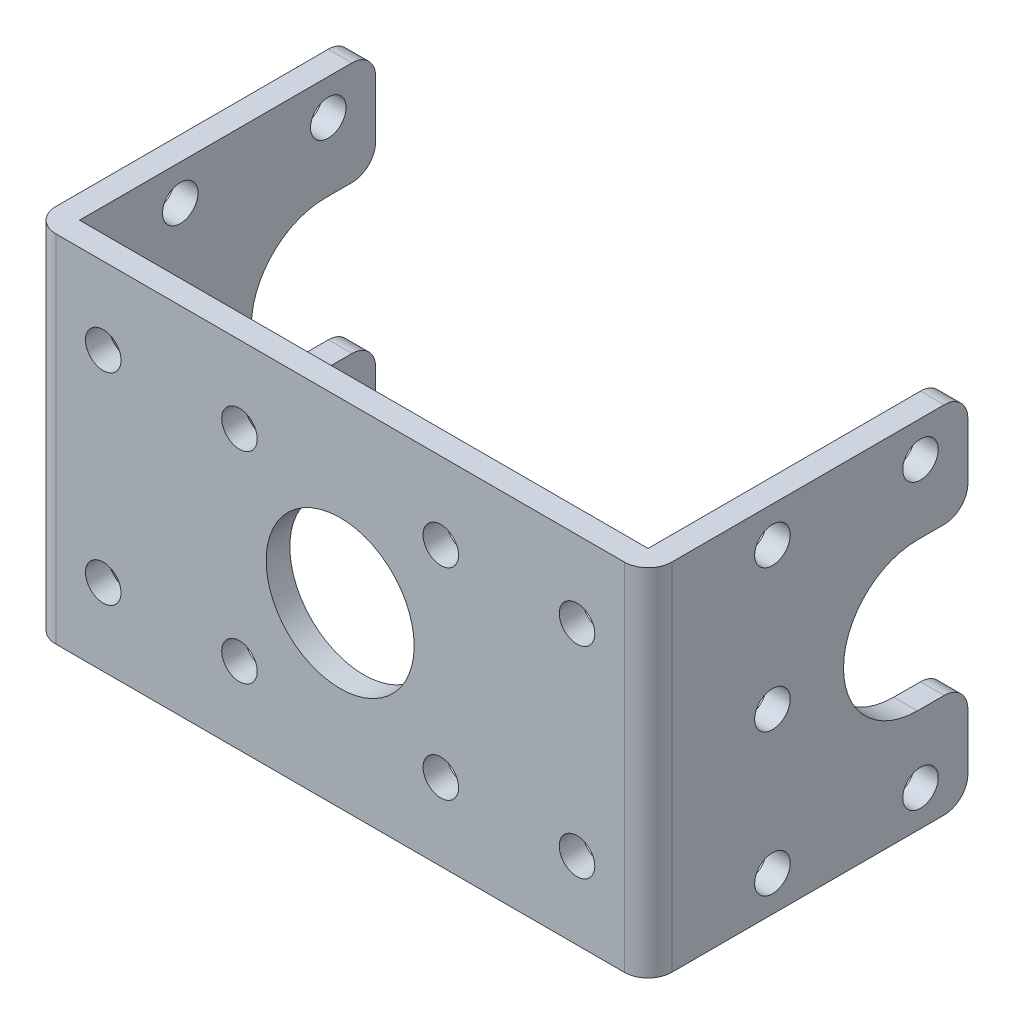
from build123d import *

# Parameters (mm, degrees)
BOSS_EXTRUDE1_DEPTH = 30
SKETCH2_R           = 1.5
CUT_EXTRUDE1_DEPTH  = 66.825526963
SKETCH3_R           = 6.25
SKETCH3_R_2         = 1.5
CUT_EXTRUDE2_DEPTH  = 30
FILLET1_R           = 2


with BuildPart() as part:
    # Sketch1 → Boss-Extrude1 (new body)
    with BuildSketch(Plane(origin=(0, 0, 0), x_dir=(1, 0, 0), z_dir=(0, 1, 0))):
        Polygon((24, 0), (24, -25), (-24, -25), (-24, 0), (-26, 0), (-26, -27), (26, -27), (26, 0), align=None)
    extrude(amount=BOSS_EXTRUDE1_DEPTH)

    # Sketch2 → Cut-Extrude1 (cut, through all)
    with BuildSketch(Plane(origin=(26, 0, 0), x_dir=(0, 0, -1), z_dir=(1, 0, 0))):
        with Locations((-4, 27)):
            Circle(SKETCH2_R)
        with Locations((-4, 3)):
            Circle(SKETCH2_R)
        with Locations((-16.5, 15)):
            Circle(SKETCH2_R)
        with Locations((-16.5, 27)):
            Circle(SKETCH2_R)
        with Locations((-16.5, 3)):
            Circle(SKETCH2_R)
        with BuildLine():
            Line((-4.25, 21.25), (0, 21.25))
            Line((0, 21.25), (0, 8.75))
            Line((0, 8.75), (-4.25, 8.75))
            ThreePointArc((-4.25, 8.75), (-10.5, 15), (-4.25, 21.25))
        make_face()
    extrude(amount=-CUT_EXTRUDE1_DEPTH, mode=Mode.SUBTRACT)

    # Sketch3 → Cut-Extrude2 (cut)
    with BuildSketch(Plane.XY.offset(27)):
        with Locations((0, 15)):
            Circle(SKETCH3_R)
        with Locations((20, 23.5)):
            Circle(SKETCH3_R_2)
        with Locations((20, 6.5)):
            Circle(SKETCH3_R_2)
        with Locations((8.5, 6.5)):
            Circle(SKETCH3_R_2)
        with Locations((8.5, 23.5)):
            Circle(SKETCH3_R_2)
        with Locations((-8.5, 6.5)):
            Circle(SKETCH3_R_2)
        with Locations((-20, 6.5)):
            Circle(SKETCH3_R_2)
        with Locations((-8.5, 23.5)):
            Circle(SKETCH3_R_2)
        with Locations((-20, 23.5)):
            Circle(SKETCH3_R_2)
    extrude(amount=-CUT_EXTRUDE2_DEPTH, mode=Mode.SUBTRACT)

    # Fillet1
    fillet1_edges = [part.edges().sort_by_distance(p)[0] for p in [
        (-25, 21.25, 0),
        (-25, 30, 0),
        (-25, 8.75, 0),
        (-25, 0, 0),
        (25, 0, 0),
        (25, 8.75, 0),
        (25, 21.25, 0),
        (25, 30, 0),
        (26, 15, 27),
        (-26, 15, 27),
    ]]
    fillet(fillet1_edges, radius=FILLET1_R)


solid = part.part
